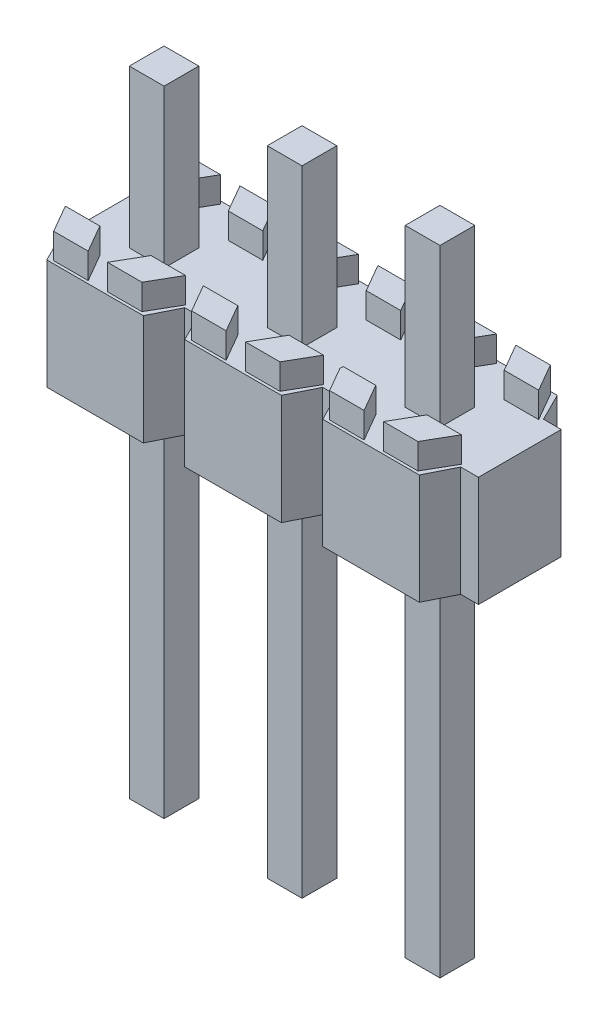
from build123d import *

# Parameters (mm, degrees)
BOSS_EXTRUDE1_START = -1.02
SKETCH1_W           = 0.64
SKETCH1_H           = 0.64
BOSS_EXTRUDE1_DEPTH = 2.5
CUT_EXTRUDE2_DEPTH  = 0.47
SKETCH3_W           = 0.64
SKETCH3_H           = 0.64
BOSS_EXTRUDE2_DEPTH = 2.9
SKETCH4_W           = 0.64
SKETCH4_H           = 0.64
BOSS_EXTRUDE3_DEPTH = 6.75
LPATTERN1_COUNT     = 3
LPATTERN1_PITCH     = 2.54


with BuildPart() as part:
    # Sketch1 → Boss-Extrude1 (new body)
    with BuildSketch(Plane(origin=(0, 0, 0), x_dir=(1, 0, 0), z_dir=(0, 1, 0)).offset(BOSS_EXTRUDE1_START)):
        Polygon((-1.143, 0.762), (-0.889, 1.27), (0.889, 1.27), (1.143, 0.762), (1.47, 0.762), (1.47, -0.762), (1.143, -0.762), (0.889, -1.27), (-0.889, -1.27), (-1.143, -0.762), align=None)
        Rectangle(SKETCH1_W, SKETCH1_H, mode=Mode.SUBTRACT)
    boss_extrude1 = extrude(amount=BOSS_EXTRUDE1_DEPTH)

    # Sketch2 → Cut-Extrude2 (cut)
    with BuildSketch(Plane(origin=(0, 1.48, 0), x_dir=(1, 0, 0), z_dir=(0, 1, 0))):
        Polygon((-1.143, 0.762), (-1.143, -0.762), (-0.889, -1.27), (0.889, -1.27), (1.143, -0.762), (1.47, -0.762), (1.47, 0.762), (1.143, 0.762), (0.889, 1.27), (-0.889, 1.27), align=None)
        Polygon((-1.106093937, -0.7112), (-0.471093937, -0.7112), (-0.1778, -1.2192), (-0.8128, -1.2192), align=None, mode=Mode.SUBTRACT)
        Polygon((-0.8128, 1.2192), (-1.106093937, 0.7112), (-0.471093937, 0.7112), (-0.1778, 1.2192), align=None, mode=Mode.SUBTRACT)
        Polygon((1.106093937, 0.7112), (0.471093937, 0.7112), (0.1778, 1.2192), (0.8128, 1.2192), align=None, mode=Mode.SUBTRACT)
        Polygon((0.8128, -1.2192), (1.106093937, -0.7112), (0.471093937, -0.7112), (0.1778, -1.2192), align=None, mode=Mode.SUBTRACT)
    cut_extrude2 = extrude(amount=-CUT_EXTRUDE2_DEPTH, mode=Mode.SUBTRACT)


with BuildPart() as body_2:
    # Sketch3 → Boss-Extrude2 (new body)
    with BuildSketch(Plane(origin=(0, 1.01, 0), x_dir=(1, 0, 0), z_dir=(0, 1, 0))):
        Rectangle(SKETCH3_W, SKETCH3_H)
    boss_extrude2 = extrude(amount=BOSS_EXTRUDE2_DEPTH)


with BuildPart() as body_3:
    # Sketch4 → Boss-Extrude3 (new body)
    with BuildSketch(Plane.XZ.offset(1.02)):
        Rectangle(SKETCH4_W, SKETCH4_H)
    boss_extrude3 = extrude(amount=BOSS_EXTRUDE3_DEPTH)


with BuildPart() as part_1:
    add(part.part)

    # LPattern1: Boss-Extrude1, Cut-Extrude2, Boss-Extrude2, Boss-Extrude3 ×3
    with Locations(*[(i * LPATTERN1_PITCH, 0, 0) for i in range(1, LPATTERN1_COUNT)]):
        add(boss_extrude1)
        add(cut_extrude2, mode=Mode.SUBTRACT)
        add(boss_extrude2)
        add(boss_extrude3)


solid = Compound([body_2.part, body_3.part, part_1.part])
